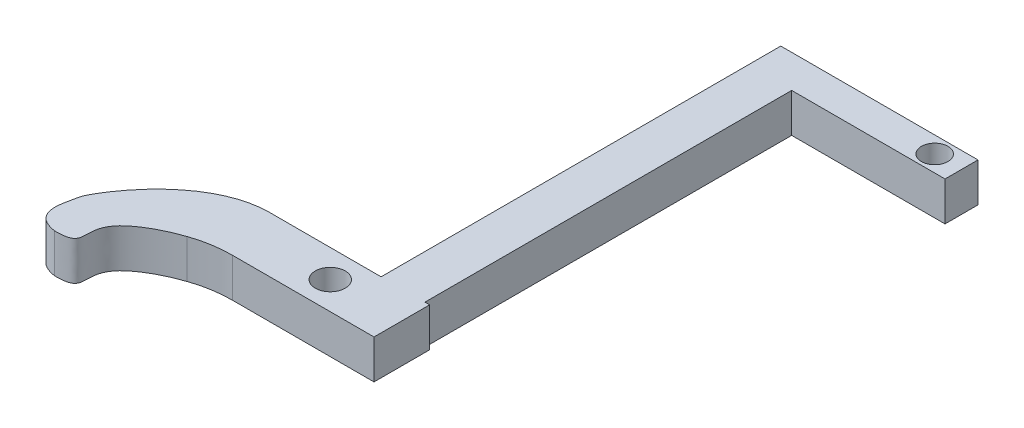
from build123d import *

# Parameters (mm, degrees)
SKETCH2_R           = 1.5
SKETCH2_W           = 4.390155439
SKETCH2_H           = 40
BOSS_EXTRUDE1_DEPTH = 3.9
FILLET3_DEPTH       = 3.9
SKETCH3_W           = 19.737208952
SKETCH3_H           = 3.300323738
SKETCH3_R           = 1.325393383
BOSS_EXTRUDE2_DEPTH = 3.9


with BuildPart() as part:
    # Sketch2 → Boss-Extrude1 (new body)
    # profile 1 of 2: a face of its own
    with BuildSketch(Plane(origin=(0, 0, 0), x_dir=(1, 0, 0), z_dir=(0, 1, 0))):
        with BuildLine():
            Line((19.123436496, 25.701081922), (34.59754825, 25.701081922))
            Line((34.59754825, 25.701081922), (34.59754825, 20.132358135))
            Line((34.59754825, 20.132358135), (19.123436496, 20.132358135))
            add(Edge.make_bspline(
                [(19.123436496, 20.132358135), (16.216005931, 19.675871056), (8.717763219, 15.948180567), (12.775822081, 13.309851453), (9.394712639, 13.342677758)],
                knots=[0, 0, 0, 0, 0.368689926, 1, 1, 1, 1], degree=3))
            add(Edge.make_bspline(
                [(9.394712639, 13.342677758), (6.794270731, 13.776084743), (7.423714975, 16.094608856), (7.961055752, 18.618185123), (13.166799439, 25.974660635), (19.123436496, 25.701081922)],
                knots=[0, 0, 0, 0, 0.580649742, 0.680649742, 1, 1, 1, 1], degree=3))
        make_face()
        with Locations(Location((27.434396639, 22.916720028, 0), (0, 0, 270))):
            Circle(SKETCH2_R, mode=Mode.SUBTRACT)
    # profile 2 of 2: a face of its own
    with BuildSketch(Plane(origin=(0, 0, 0), x_dir=(1, 0, 0), z_dir=(0, 1, 0))):
        with Locations((31.933571829, 45.701081922)):
            Rectangle(SKETCH2_W, SKETCH2_H)
    extrude(amount=BOSS_EXTRUDE1_DEPTH)

    # Fillet3: read off the stored shape, not the designer's step
    # Fillet3 outline → Fillet3 (add)
    with BuildSketch(Plane(origin=(0, 0, 0), x_dir=(1, 0, 0), z_dir=(0, 1, 0))):
        with BuildLine():
            Line((19.123436496, 25.701081922), (19.342243741, 25.701081922))
            ThreePointArc((19.342243741, 25.701081922), (19.160798603, 25.702453764), (18.979394951, 25.706568978))
            add(Edge.make_bspline(
                [(18.979394951, 25.706568978), (19.027278337, 25.705120447), (19.075292343, 25.703293105), (19.123436496, 25.701081922)],
                knots=[0.997418871, 0.997418871, 0.997418871, 0.997418871, 1, 1, 1, 1], degree=3))
        make_face()
        with BuildLine():
            add(Edge.make_bspline(
                [(19.123436496, 20.132358135), (18.238088744, 19.993352301), (17.36599214, 19.769234125), (16.54746782, 19.490102613)],
                knots=[0, 0, 0, 0, 0.112270539, 0.112270539, 0.112270539, 0.112270539], degree=3))
            ThreePointArc((16.54746782, 19.490102613), (18.457621126, 19.970705438), (20.420662932, 20.132358135))
            Line((20.420662932, 20.132358135), (19.123436496, 20.132358135))
        make_face()
    extrude(amount=FILLET3_DEPTH)

    # Sketch3 → Boss-Extrude2 (add)
    with BuildSketch(Plane(origin=(0, 3.9, 0), x_dir=(1, 0, 0), z_dir=(0, 1, 0))):
        with Locations((39.607098585, 64.050920053)):
            Rectangle(SKETCH3_W, SKETCH3_H)
        with Locations(Location((46.791397241, 64.050920053, 0), (0, 0, 270))):
            Circle(SKETCH3_R, mode=Mode.SUBTRACT)
    extrude(amount=-BOSS_EXTRUDE2_DEPTH)


solid = part.part
